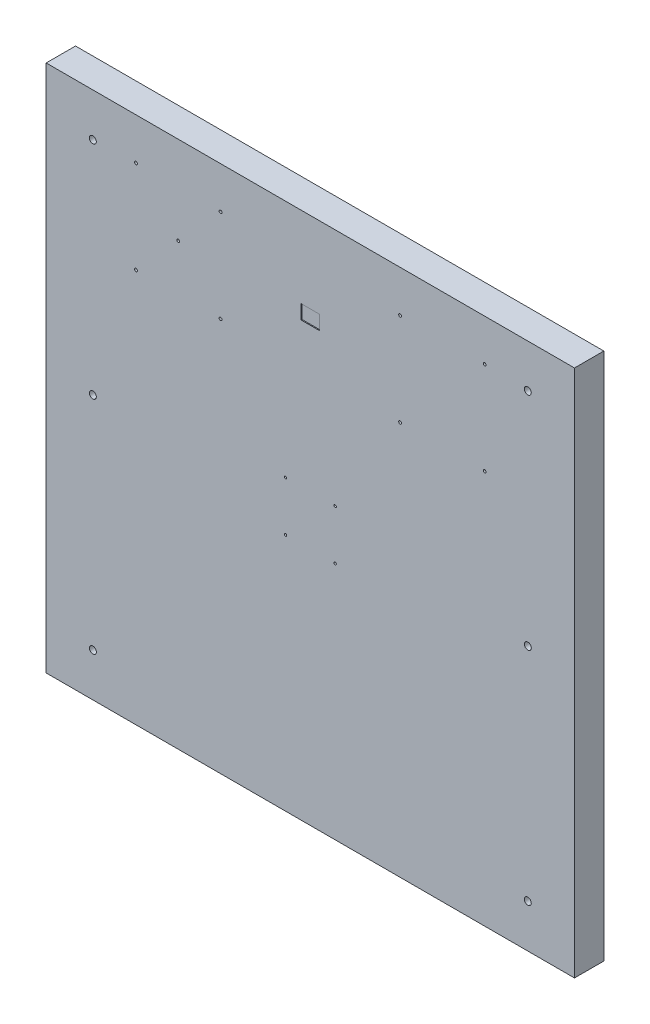
from build123d import *

# Parameters (mm, degrees)
SKETCH1_W             = 457.2
SKETCH1_H             = 457.2
SKETCH1_R             = 3
BOSS_EXTRUDE1_DEPTH   = 25.4
M3_TAPPED_HOLE1_D     = 2.5
M3_TAPPED_HOLE1_DEPTH = 6
M3_TAPPED_HOLE1_TIP   = 0.751075774
CUT_EXTRUDE1_DEPTH    = 0.82


# Read off the part's stored shape, not the designer's step: M2.5 Tapped Hole1
with BuildPart() as part:
    # Sketch1 → Boss-Extrude1 (new body)
    with BuildSketch(Plane.XY):
        Rectangle(SKETCH1_W, SKETCH1_H)
        with Locations((-188.2, 191.2)):
            Circle(SKETCH1_R, mode=Mode.SUBTRACT)
        with Locations((-188.2, 0)):
            Circle(SKETCH1_R, mode=Mode.SUBTRACT)
        with Locations(Location((188.2, 191.2, 0), (0, 0, 180))):
            Circle(SKETCH1_R, mode=Mode.SUBTRACT)
        with Locations(Location((188.2, 0, 0), (0, 0, 180))):
            Circle(SKETCH1_R, mode=Mode.SUBTRACT)
        with Locations((188.2, -191.2)):
            Circle(SKETCH1_R, mode=Mode.SUBTRACT)
        with Locations(Location((-188.2, -191.2, 0), (0, 0, 180))):
            Circle(SKETCH1_R, mode=Mode.SUBTRACT)
    extrude(amount=BOSS_EXTRUDE1_DEPTH)

    # M2.5 Tapped Hole1 outline → M2.5 Tapped Hole1 (revolve, cut)
    with BuildSketch(Plane(origin=(21.5, 21.5, 0), x_dir=(1, 0, 0), z_dir=(0, -1, 0))):
        Polygon((0, 25.4), (0, 20.784117865), (1.025, 21.4), (1.025, 25.4), align=None)
    revolve(axis=Axis((21.5, 21.5, 0), (0, 0, 1)), mode=Mode.SUBTRACT)

    # M2.5 Tapped Hole1 2 outline → M2.5 Tapped Hole1 2 (revolve, cut)
    with BuildSketch(Plane(origin=(-21.5, -21.5, 0), x_dir=(1, 0, 0), z_dir=(0, -1, 0))):
        Polygon((0, 25.4), (0, 20.784117865), (1.025, 21.4), (1.025, 25.4), align=None)
    revolve(axis=Axis((-21.5, -21.5, 0), (0, 0, 1)), mode=Mode.SUBTRACT)

    # M2.5 Tapped Hole1 3 outline → M2.5 Tapped Hole1 3 (revolve, cut)
    with BuildSketch(Plane(origin=(-21.5, 21.5, 0), x_dir=(1, 0, 0), z_dir=(0, -1, 0))):
        Polygon((0, 25.4), (0, 20.784117865), (1.025, 21.4), (1.025, 25.4), align=None)
    revolve(axis=Axis((-21.5, 21.5, 0), (0, 0, 1)), mode=Mode.SUBTRACT)

    # M2.5 Tapped Hole1 4 outline → M2.5 Tapped Hole1 4 (revolve, cut)
    with BuildSketch(Plane(origin=(21.5, -21.5, 0), x_dir=(1, 0, 0), z_dir=(0, -1, 0))):
        Polygon((0, 25.4), (0, 20.784117865), (1.025, 21.4), (1.025, 25.4), align=None)
    revolve(axis=Axis((21.5, -21.5, 0), (0, 0, 1)), mode=Mode.SUBTRACT)

    # M3 Tapped Hole1
    with Locations(Plane.XY.offset(25.4)):
        with Locations((-114.3, 152.4), (-77.7, 112.3), (-150.9, 192.5), (-150.9, 112.3), (-77.7, 192.5), (150.9, 112.3), (77.7, 192.5), (150.9, 192.5), (77.7, 112.3)):
            Hole(M3_TAPPED_HOLE1_D / 2, depth=M3_TAPPED_HOLE1_DEPTH)
            with Locations((0, 0, -(M3_TAPPED_HOLE1_DEPTH + M3_TAPPED_HOLE1_TIP / 2))):  # 118° drill point
                Cone(0, M3_TAPPED_HOLE1_D / 2, M3_TAPPED_HOLE1_TIP, mode=Mode.SUBTRACT)

    # Sketch8 → Cut-Extrude1 (cut)
    with BuildSketch(Plane.XY.offset(25.4)):
        Polygon((0, 152.4), (-8.06, 158.56), (-8.06, 146.24), align=None)
        Polygon((8.06, 158.56), (-8.06, 158.56), (0, 152.4), align=None)
        Polygon((8.06, 146.24), (8.06, 158.56), (0, 152.4), align=None)
        Polygon((0, 152.4), (-8.06, 146.24), (8.06, 146.24), align=None)
    extrude(amount=-CUT_EXTRUDE1_DEPTH, mode=Mode.SUBTRACT)


solid = part.part
